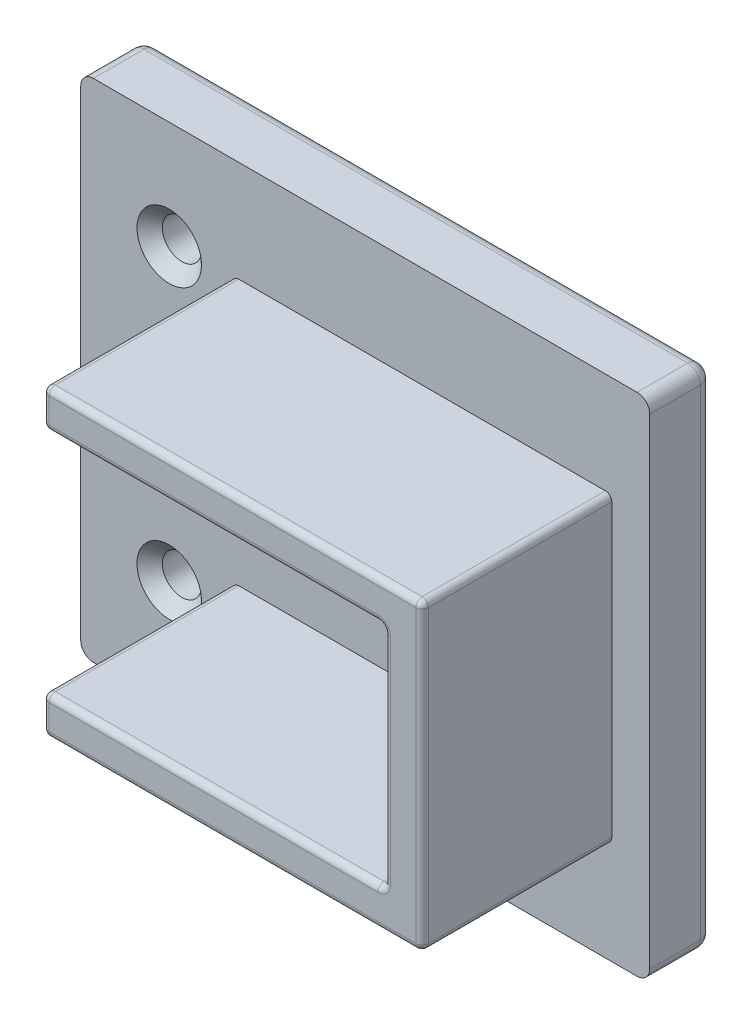
from build123d import *

# Parameters (mm, degrees)
SKETCH_2_W          = 45
SKETCH_2_H          = 40
EXTRUDE_1_DEPTH     = 5
EXTRUDE_START       = -8
SKETCH_5_W          = 30
SKETCH_5_H          = 15
EXTRUDE_2_DEPTH     = 3
SKETCH_6_W          = 30
SKETCH_6_H          = 15
EXTRUDE_3_DEPTH     = 3
CUT_EXTRUDE_1_REACH = 39.749
SKETCH_7_R          = 1.55
SKETCH_8_W          = 15
SKETCH_8_H          = 21
EXTRUDE_4_DEPTH     = 3
FILLET_4_R          = 0.5
CHAMFER_1_SIZE      = 1
FILLET_3_R          = 1


with BuildPart() as part:
    # 草图2 → 凸台-拉伸1 (new body)
    with BuildSketch(Plane.XY):
        with Locations((2.5, 0)):
            Rectangle(SKETCH_2_W, SKETCH_2_H)
    extrude(amount=EXTRUDE_1_DEPTH)

    # 草图5 → 凸台-拉伸2 (add)
    with BuildSketch(Plane.XZ.offset(20).offset(EXTRUDE_START)):
        with Locations((7, 12.5)):
            Rectangle(SKETCH_5_W, SKETCH_5_H)
    extrude(amount=-EXTRUDE_2_DEPTH)

    # 草图6 → 凸台-拉伸3 (add)
    with BuildSketch(Plane(origin=(0, 20, 0), x_dir=(1, 0, 0), z_dir=(0, 1, 0)).offset(EXTRUDE_START)):
        with Locations((7, -12.5)):
            Rectangle(SKETCH_6_W, SKETCH_6_H)
    extrude(amount=-EXTRUDE_3_DEPTH)

    # 草图7 → 切除-拉伸1 (cut, up to next)
    with BuildSketch(Plane(origin=(0, 0, 0), x_dir=(-1, 0, 0), z_dir=(0, 0, -1)), mode=Mode.PRIVATE) as cut_extrude_1_sk1:
        with Locations((-12, 0)):
            Circle(SKETCH_7_R)
    cut_extrude_1_tool1 = extrude(cut_extrude_1_sk1.sketch, amount=-CUT_EXTRUDE_1_REACH, mode=Mode.PRIVATE) & part.part
    # 草图7 → 切除-拉伸1 (cut, up to next)
    with BuildSketch(Plane(origin=(0, 0, 0), x_dir=(-1, 0, 0), z_dir=(0, 0, -1)), mode=Mode.PRIVATE) as cut_extrude_1_sk2:
        with Locations((13, -11.5)):
            Circle(SKETCH_7_R)
    cut_extrude_1_tool2 = extrude(cut_extrude_1_sk2.sketch, amount=-CUT_EXTRUDE_1_REACH, mode=Mode.PRIVATE) & part.part
    # 草图7 → 切除-拉伸1 (cut, up to next)
    with BuildSketch(Plane(origin=(0, 0, 0), x_dir=(-1, 0, 0), z_dir=(0, 0, -1)), mode=Mode.PRIVATE) as cut_extrude_1_sk3:
        with Locations((13, 11.5)):
            Circle(SKETCH_7_R)
    cut_extrude_1_tool3 = extrude(cut_extrude_1_sk3.sketch, amount=-CUT_EXTRUDE_1_REACH, mode=Mode.PRIVATE) & part.part
    add(cut_extrude_1_tool1.solids().sort_by_distance((12, 0, 0))[0], mode=Mode.SUBTRACT)
    add(cut_extrude_1_tool2.solids().sort_by_distance((-13, -11.5, 0))[0], mode=Mode.SUBTRACT)
    add(cut_extrude_1_tool3.solids().sort_by_distance((-13, 11.5, 0))[0], mode=Mode.SUBTRACT)

    # 草图8 → 凸台-拉伸4 (add)
    with BuildSketch(Plane(origin=(22, 0, 0), x_dir=(0, 0, -1), z_dir=(1, 0, 0))):
        with Locations((-12.5, -1.5)):
            Rectangle(SKETCH_8_W, SKETCH_8_H)
    extrude(amount=-EXTRUDE_4_DEPTH)

    # 圆角4
    fillet_4_edges = [part.edges().sort_by_distance(p)[0] for p in [
        (5.5, 9, 20),
        (-8, 10.5, 20),
        (7, 12, 20),
        (22, 0, 20),
        (7, -12, 20),
        (-8, -10.5, 20),
        (5.5, -9, 20),
        (19, 0, 20),
        (19, -9, 12.5),
        (-8, -9, 12.5),
        (-8, -12, 12.5),
        (22, 12, 12.5),
        (-8, 12, 12.5),
        (-8, 9, 12.5),
        (19, 9, 12.5),
        (22, -12, 12.5),
    ]]
    fillet(fillet_4_edges, radius=FILLET_4_R)

    # 倒角1
    chamfer_1_edges = [part.edges().sort_by_distance(p)[0] for p in [
        (-11.45, 11.5, 5),
        (-11.45, 11.5, 0),
        (-11.45, -11.5, 5),
        (-11.45, -11.5, 0),
        (13.55, 0, 5),
        (13.55, 0, 0),
    ]]
    chamfer(chamfer_1_edges, length=CHAMFER_1_SIZE)

    # 圆角3
    fillet_3_edges = [part.edges().sort_by_distance(p)[0] for p in [
        (-20, -20, 2.5),
        (-20, 20, 2.5),
        (25, 20, 2.5),
        (25, -20, 2.5),
        (2.5, 20, 0),
        (-20, 0, 0),
        (2.5, -20, 0),
        (25, 0, 0),
        (14.55, 0, 0),
        (-10.45, -11.5, 0),
        (-10.45, 11.5, 0),
    ]]
    fillet(fillet_3_edges, radius=FILLET_3_R)


solid = part.part
